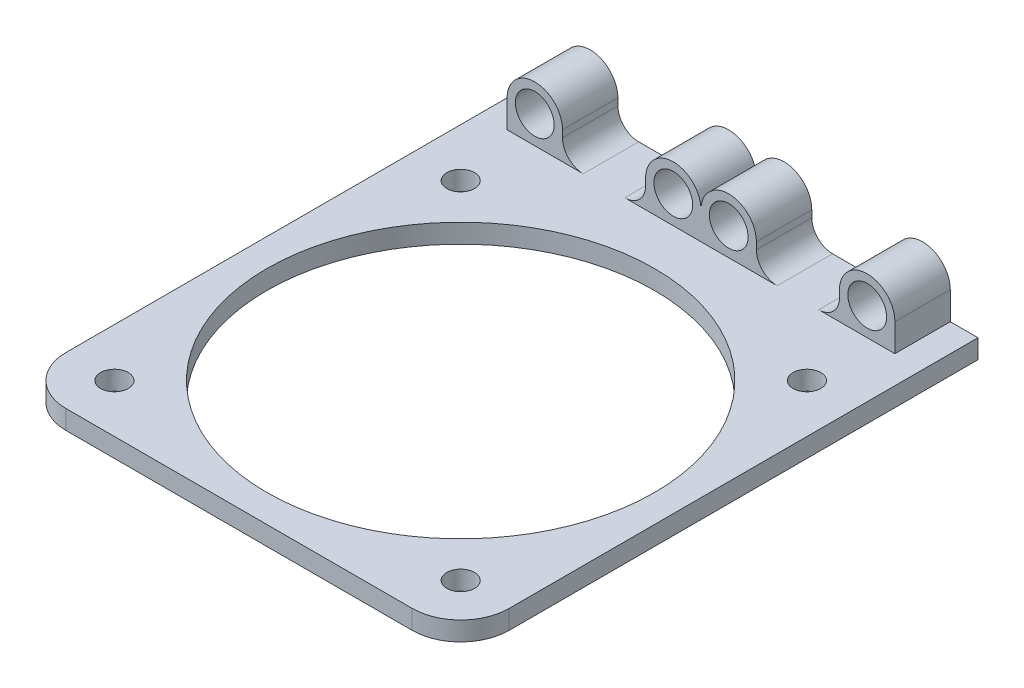
from build123d import *

# Parameters (mm, degrees)
SCHIZZO1_R                        = 2
ESTRUSIONE_ESTRUSIONE1_DEPTH      = 8
SCHIZZO3_W                        = 50
SCHIZZO3_H                        = 2.75
ESTRUSIONE_ESTRUSIONE3_DEPTH      = 55
RACCORDO1_R                       = 4
SCHIZZO4_R                        = 23
TAGLIO_ESTRUSIONE1_DEPTH          = 4
SCHIZZO5_R                        = 2
TAGLIO_ESTRUSIONE2_DEPTH          = 4
RACCORDO2_R                       = 124
SCHIZZO6_R                        = 2.8
TAGLIO_ESTRUSIONE3_DEPTH          = 4
SCHIZZO7_W                        = 64
SCHIZZO7_H                        = 66
SCHIZZO7_R                        = 28
ESTRUSIONE_ESTRUSIONE4_DEPTH      = 4
SCHIZZO8_R                        = 28
TAGLIO_ESTRUSIONE4_DEPTH          = 10
SCHIZZO9_R                        = 2
TAGLIO_ESTRUSIONE5_DEPTH          = 4
RACCORDO3_R                       = 3
RACCORDO4_R                       = 3
RACCORDO5_R                       = 3
SCHIZZO10_W                       = 88.736042833
SCHIZZO10_H                       = 81.022332295
TAGLIO_ESTRUSIONE6_DEPTH          = 1.25
SCHIZZO11_W                       = 58
SCHIZZO11_H                       = 2.75
ESTRUSIONE_ESTRUSIONE5_DEPTH      = 0.7
RACCORDO6_START                   = -1
RACCORDO6_DEPTH                   = 5
RACCORDO8_START                   = -1
RACCORDO8_DEPTH                   = 5
ESTRUSIONE_ESTRUSIONE6_DEPTH      = 4
ESTRUSIONE_ESTRUSIONE6_DEPTH_BACK = 2.75
SCHIZZO12_W                       = 64
SCHIZZO12_H                       = 11.748328584
TAGLIO_ESTRUSIONE7_DEPTH          = 4
SCHIZZO15_W                       = 64
SCHIZZO15_H                       = 14.540634193
TAGLIO_ESTRUSIONE8_DEPTH          = 4


with BuildPart() as part:
    # Schizzo1 → Estrusione-Estrusione1 (new body)
    with BuildSketch(Plane.XY):
        with BuildLine():
            Line((-59.484364928, 0), (-3.484364928, 0))
            Line((-3.484364928, 0), (-3.484364928, 6.75))
            ThreePointArc((-3.484364928, 6.75), (-7.484364928, 10.75), (-11.484364928, 6.75))
            Line((-11.484364928, 6.75), (-11.484364928, 2.75))
            Line((-11.484364928, 2.75), (-23.484364928, 2.75))
            Line((-23.484364928, 2.75), (-23.484364928, 6.75))
            ThreePointArc((-23.484364928, 6.75), (-27.484364928, 10.75), (-31.484364928, 6.75))
            ThreePointArc((-31.484364928, 6.75), (-35.484364928, 10.75), (-39.484364928, 6.75))
            Line((-39.484364928, 6.75), (-39.484364928, 2.75))
            Line((-39.484364928, 2.75), (-51.484364928, 2.75))
            Line((-51.484364928, 2.75), (-51.484364928, 6.75))
            ThreePointArc((-51.484364928, 6.75), (-55.484364928, 10.75), (-59.484364928, 6.75))
            Line((-59.484364928, 6.75), (-59.484364928, 0))
        make_face()
        with Locations((-35.484364928, 6.75)):
            Circle(SCHIZZO1_R, mode=Mode.SUBTRACT)
        with Locations(Location((-27.484364928, 6.75, 0), (0, 0, 180))):
            Circle(SCHIZZO1_R, mode=Mode.SUBTRACT)
        with Locations((-55.484364928, 6.75)):
            Circle(SCHIZZO1_R, mode=Mode.SUBTRACT)
        with Locations(Location((-7.484364928, 6.75, 0), (0, 0, 180))):
            Circle(SCHIZZO1_R, mode=Mode.SUBTRACT)
    extrude(amount=ESTRUSIONE_ESTRUSIONE1_DEPTH)

    # Schizzo3 → Estrusione-Estrusione3 (add)
    with BuildSketch(Plane.XY.offset(8)):
        with Locations((-31.482821648, 1.375)):
            Rectangle(SCHIZZO3_W, SCHIZZO3_H)
    extrude(amount=ESTRUSIONE_ESTRUSIONE3_DEPTH)

    # Raccordo1
    raccordo1_edges = [part.edges().sort_by_distance(p)[0] for p in [
        (-56.482821648, 1.375, 63),
        (-6.482821648, 1.375, 63),
    ]]
    fillet(raccordo1_edges, radius=RACCORDO1_R)

    # Schizzo4 → Taglio-Estrusione1 (cut)
    with BuildSketch(Plane(origin=(0, 2.75, 0), x_dir=(1, 0, 0), z_dir=(0, 1, 0))):
        with Locations(Location((-31.482821648, -35.97589666, 0), (0, 0, 180))):
            Circle(SCHIZZO4_R)
    extrude(amount=-TAGLIO_ESTRUSIONE1_DEPTH, mode=Mode.SUBTRACT)

    # Schizzo5 → Taglio-Estrusione2 (cut)
    with BuildSketch(Plane(origin=(0, 2.75, 0), x_dir=(1, 0, 0), z_dir=(0, 1, 0))):
        with Locations(Location((-51.482821648, -15.97589666, 0), (0, 0, 180))):
            Circle(SCHIZZO5_R)
        with Locations(Location((-51.482821648, -55.97589666, 0), (0, 0, 180))):
            Circle(SCHIZZO5_R)
        with Locations(Location((-11.482821648, -15.97589666, 0), (0, 0, 180))):
            Circle(SCHIZZO5_R)
        with Locations(Location((-11.482821648, -55.97589666, 0), (0, 0, 180))):
            Circle(SCHIZZO5_R)
    extrude(amount=-TAGLIO_ESTRUSIONE2_DEPTH, mode=Mode.SUBTRACT)

    # Raccordo2
    # the kernel refuses this fillet: 124 mm, written as the material it adds along each edge
    with BuildSketch(Plane(origin=(-56.482821648, 2.75, 8), x_dir=(0, 0, 1), z_dir=(0, -1, 0))) as raccordo2_piece_1:
        with BuildLine():
            CenterArc((27.117770399, 124), RACCORDO2_R, 257.367798326, 12.632201674)
            Line((0, 3.00154328), (0, 0))
            Line((0, 0), (27.117770399, 0))
        make_face()
    extrude(amount=2.75)
    with BuildSketch(Plane(origin=(-6.482821648, 0, 8), x_dir=(0, 0, 1), z_dir=(0, 1, 0))) as raccordo2_piece_2:
        with BuildLine():
            CenterArc((27.10399461, 124), RACCORDO2_R, 257.374321421, 12.625678579)
            Line((0, 2.99845672), (0, 0))
            Line((0, 0), (27.10399461, 0))
        make_face()
    extrude(amount=2.75)

    # Schizzo6 → Taglio-Estrusione3 (cut)
    with BuildSketch(Plane.XY.offset(8)):
        with Locations((-55.484364928, 6.75)):
            Circle(SCHIZZO6_R)
        with Locations((-35.484364928, 6.75)):
            Circle(SCHIZZO6_R)
        with Locations((-27.48263887, 6.745335699)):
            Circle(SCHIZZO6_R)
        with Locations((-7.48260826, 6.745335699)):
            Circle(SCHIZZO6_R)
    extrude(amount=-TAGLIO_ESTRUSIONE3_DEPTH, mode=Mode.SUBTRACT)

    # Schizzo7 → Estrusione-Estrusione4 (add)
    with BuildSketch(Plane(origin=(0, 2.75, 0), x_dir=(1, 0, 0), z_dir=(0, 1, 0))):
        with Locations((-31.484364928, -41)):
            Rectangle(SCHIZZO7_W, SCHIZZO7_H)
        with Locations(Location((-31.484364928, -42.7, 0), (0, 0, 180))):
            Circle(SCHIZZO7_R, mode=Mode.SUBTRACT)
    extrude(amount=-ESTRUSIONE_ESTRUSIONE4_DEPTH)

    # Schizzo8 → Taglio-Estrusione4 (cut)
    with BuildSketch(Plane(origin=(0, 2.75, 0), x_dir=(1, 0, 0), z_dir=(0, 1, 0))):
        with Locations(Location((-31.484364928, -42.7, 0), (0, 0, 180))):
            Circle(SCHIZZO8_R)
    extrude(amount=-TAGLIO_ESTRUSIONE4_DEPTH, mode=Mode.SUBTRACT)

    # Schizzo9 → Taglio-Estrusione5 (cut)
    with BuildSketch(Plane(origin=(0, 2.75, 0), x_dir=(1, 0, 0), z_dir=(0, 1, 0))):
        with Locations(Location((-6.484364928, -67.7, 0), (0, 0, 180))):
            Circle(SCHIZZO9_R)
        with Locations((-6.484364928, -17.7)):
            Circle(SCHIZZO9_R)
        with Locations((-56.484364928, -67.7)):
            Circle(SCHIZZO9_R)
        with Locations(Location((-56.484364928, -17.7, 0), (0, 0, 180))):
            Circle(SCHIZZO9_R)
    extrude(amount=-TAGLIO_ESTRUSIONE5_DEPTH, mode=Mode.SUBTRACT)

    # Raccordo3
    # the kernel refuses this fillet: 3 mm, written as the material it adds along each edge
    with BuildSketch(Plane(origin=(-59.484364928, 0, 8), x_dir=(0, -1, 0), z_dir=(1, 0, 0))) as raccordo3_piece_1:
        with BuildLine():
            CenterArc((3, 2.436698586), RACCORDO3_R, 180, 54.314665287)
            Line((0, 2.436698586), (0, 0))
            Line((0, 0), (1.25, 0))
        make_face()
    extrude(amount=56)
    with BuildSketch(Plane(origin=(-3.484364928, 0, 8), x_dir=(1, 0, 0), z_dir=(0, 1, 0)), Plane(origin=(-59.484364928, 2.75, 8), x_dir=(-1, 0, 0), z_dir=(0, -1, 0))) as raccordo3_piece_2:
        with BuildLine():
            CenterArc((RACCORDO3_R, RACCORDO3_R), RACCORDO3_R, 180, 90)
            Line((0, RACCORDO3_R), (0, 0))
            Line((0, 0), (RACCORDO3_R, 0))
        make_face()
    extrude(amount=2.75)
    with BuildSketch(Plane(origin=(-65.576111393, 0, 8), x_dir=(0, -1, 0), z_dir=(1, 0, 0))) as raccordo3_piece_3a_section:
        with BuildLine():
            CenterArc((3, 2.436698586), RACCORDO3_R, 180, 54.314665287)
            Line((0, 2.436698586), (0, 0))
            Line((0, 0), (1.25, 0))
        make_face()
    raccordo3_piece_3a = extrude(amount=62.091746466, mode=Mode.PRIVATE)
    raccordo3_piece_3a = split(raccordo3_piece_3a, bisect_by=Plane(origin=(-63.484364928, 0, 8), z_dir=(1, 0, 0)), keep=Keep.TOP, mode=Mode.PRIVATE)
    raccordo3_piece_3a = split(raccordo3_piece_3a, bisect_by=Plane(origin=(-59.484364928, 0, 8), z_dir=(-1, 0, 0)), keep=Keep.TOP, mode=Mode.PRIVATE)
    with BuildSketch(Plane(origin=(-59.484364928, 2.75, 8), x_dir=(-1, 0, 0), z_dir=(0, -1, 0))) as raccordo3_piece_3b_section:
        with BuildLine():
            CenterArc((RACCORDO3_R, RACCORDO3_R), RACCORDO3_R, 180, 90)
            Line((0, RACCORDO3_R), (0, 0))
            Line((0, 0), (RACCORDO3_R, 0))
        make_face()
    raccordo3_piece_3b = extrude(amount=10.25, mode=Mode.PRIVATE)
    raccordo3_piece_3b = split(raccordo3_piece_3b, bisect_by=Plane(origin=(-59.484364928, 0, 8), z_dir=(0, -1, 0)), keep=Keep.TOP, mode=Mode.PRIVATE)
    raccordo3_piece_3b = split(raccordo3_piece_3b, bisect_by=Plane(origin=(-59.484364928, -1.25, 8), z_dir=(0, 1, 0)), keep=Keep.TOP, mode=Mode.PRIVATE)
    raccordo3_piece_3 = raccordo3_piece_3a & raccordo3_piece_3b
    add(raccordo3_piece_3)
    with BuildSketch(Plane(origin=(-3.484364928, -7.5, 8), x_dir=(1, 0, 0), z_dir=(0, 1, 0))) as raccordo3_piece_4a_section:
        with BuildLine():
            CenterArc((RACCORDO3_R, RACCORDO3_R), RACCORDO3_R, 180, 90)
            Line((0, RACCORDO3_R), (0, 0))
            Line((0, 0), (RACCORDO3_R, 0))
        make_face()
    raccordo3_piece_4a = extrude(amount=10.25, mode=Mode.PRIVATE)
    raccordo3_piece_4a = split(raccordo3_piece_4a, bisect_by=Plane(origin=(-3.484364928, 0, 8), z_dir=(0, -1, 0)), keep=Keep.TOP, mode=Mode.PRIVATE)
    raccordo3_piece_4a = split(raccordo3_piece_4a, bisect_by=Plane(origin=(-3.484364928, -1.25, 8), z_dir=(0, 1, 0)), keep=Keep.TOP, mode=Mode.PRIVATE)
    with BuildSketch(Plane(origin=(-59.484364928, 0, 8), x_dir=(0, -1, 0), z_dir=(1, 0, 0))) as raccordo3_piece_4b_section:
        with BuildLine():
            CenterArc((3, 2.436698586), RACCORDO3_R, 180, 54.314665287)
            Line((0, 2.436698586), (0, 0))
            Line((0, 0), (1.25, 0))
        make_face()
    raccordo3_piece_4b = extrude(amount=62.091746466, mode=Mode.PRIVATE)
    raccordo3_piece_4b = split(raccordo3_piece_4b, bisect_by=Plane(origin=(0.515635072, 0, 8), z_dir=(-1, 0, 0)), keep=Keep.TOP, mode=Mode.PRIVATE)
    raccordo3_piece_4b = split(raccordo3_piece_4b, bisect_by=Plane(origin=(-3.484364928, 0, 8), z_dir=(1, 0, 0)), keep=Keep.TOP, mode=Mode.PRIVATE)
    raccordo3_piece_4 = raccordo3_piece_4a & raccordo3_piece_4b
    add(raccordo3_piece_4)
    # the kernel refuses this fillet: 3 mm, written as the material it takes off along each edge
    with BuildSketch(Plane(origin=(0.515635072, 10.25, 74), x_dir=(-1, 0, 0), z_dir=(0, -1, 0)), Plane(origin=(-63.484364928, 10.25, 74), x_dir=(0, 0, -1), z_dir=(0, -1, 0))) as raccordo3_2_piece_1:
        with BuildLine():
            CenterArc((RACCORDO3_R, RACCORDO3_R), RACCORDO3_R, 180, 90)
            Line((0, RACCORDO3_R), (0, 0))
            Line((0, 0), (RACCORDO3_R, 0))
        make_face()
    extrude(amount=19, mode=Mode.SUBTRACT)

    # Raccordo4
    # the kernel refuses this fillet: 3 mm, written as the material it takes off along each edge
    with BuildSketch(Plane(origin=(-63.484364928, 9.392135624, 8), x_dir=(0.9963405296085128, 0, -0.08547250469845889), z_dir=(0, -1, 0))) as raccordo4_piece_1:
        with BuildLine():
            CenterArc((2.761933602, 2.903549084), RACCORDO4_R, 184.903196278, 70.528779366)
            Line((-0.227087987, 2.64713157), (-0.525990146, 2.621489819))
            Line((-0.525990146, 2.621489819), (-0.298902159, -0.025641751))
            Line((-0.298902159, -0.025641751), (0.025641751, -0.298902159))
            ThreePointArc((0.025641751, -0.298902159), (1.021982281, -0.213429654), (1.931887045, -0.290354908))
            Line((1.931887045, -0.290354908), (2.007345823, 0))
        make_face()
    extrude(amount=17.284271247, mode=Mode.SUBTRACT)
    with BuildSketch(Plane(origin=(0.515635072, 9.392135624, 8), x_dir=(-0.9963405296085196, 0, -0.08547250469837912), z_dir=(0, -1, 0))) as raccordo4_piece_2:
        with BuildLine():
            CenterArc((2.761933602, -2.903549084), RACCORDO4_R, 104.568024357, 70.528779366)
            Line((-0.227087987, -2.64713157), (-0.525990146, -2.621489819))
            Line((-0.525990146, -2.621489819), (-0.298902159, 0.025641751))
            Line((-0.298902159, 0.025641751), (0.025641751, 0.298902159))
            ThreePointArc((0.025641751, 0.298902159), (1.021982281, 0.213429654), (1.931887045, 0.290354908))
            Line((1.931887045, 0.290354908), (2.007345823, 0))
        make_face()
    extrude(amount=17.284271247, mode=Mode.SUBTRACT)

    # Raccordo5
    raccordo5_edges = [part.edges().sort_by_distance(p)[0] for p in [
        (-39.484364928, 2.75, 4),
        (-51.484364928, 2.75, 4),
        (-23.484364928, 2.75, 4),
        (-11.484364928, 2.75, 4),
    ]]
    fillet(raccordo5_edges, radius=RACCORDO5_R)

    # Schizzo10 → Taglio-Estrusione6 (cut)
    with BuildSketch(Plane.XZ.offset(1.25)):
        with Locations((-36.992061707, 40.511166147)):
            Rectangle(SCHIZZO10_W, SCHIZZO10_H)
    extrude(amount=-TAGLIO_ESTRUSIONE6_DEPTH, mode=Mode.SUBTRACT)

    # Schizzo11 → Estrusione-Estrusione5 (add)
    with BuildSketch(Plane.XY.offset(74)):
        with Locations((-31.484364928, 1.375)):
            Rectangle(SCHIZZO11_W, SCHIZZO11_H)
    extrude(amount=ESTRUSIONE_ESTRUSIONE5_DEPTH)

    # Raccordo6: read off the stored shape, not the designer's step
    # Raccordo6 outline → Raccordo6 (cut)
    with BuildSketch(Plane(origin=(0, 0, 0), x_dir=(1, 0, 0), z_dir=(0, 1, 0)).offset(RACCORDO6_START)):
        with BuildLine():
            Line((-60.484364928, -74.7), (-56.484364928, -74.7))
            ThreePointArc((-56.484364928, -74.7), (-61.434112396, -72.649747468), (-63.484364928, -67.7))
            Line((-63.484364928, -67.7), (-63.484364928, -71))
            ThreePointArc((-63.484364928, -71), (-62.605685271, -73.121320344), (-60.484364928, -74))
            Line((-60.484364928, -74), (-60.484364928, -74.7))
        make_face()
    extrude(amount=RACCORDO6_DEPTH, mode=Mode.SUBTRACT)

    # Raccordo8: read off the stored shape, not the designer's step
    # Raccordo8 outline → Raccordo8 (cut)
    with BuildSketch(Plane(origin=(0, 0, 0), x_dir=(1, 0, 0), z_dir=(0, 1, 0)).offset(RACCORDO8_START)):
        with BuildLine():
            ThreePointArc((0.515635072, -67.7), (-1.53461746, -72.649747468), (-6.484364928, -74.7))
            Line((-6.484364928, -74.7), (-2.484364928, -74.7))
            Line((-2.484364928, -74.7), (-2.484364928, -74))
            ThreePointArc((-2.484364928, -74), (-0.363044584, -73.121320344), (0.515635072, -71))
            Line((0.515635072, -71), (0.515635072, -67.7))
        make_face()
    extrude(amount=RACCORDO8_DEPTH, mode=Mode.SUBTRACT)

    # Schizzo12 → Estrusione-Estrusione6 (add, two sides: drawn at the far end of the back side and taken through both)
    with BuildSketch(Plane.XZ.offset(-ESTRUSIONE_ESTRUSIONE6_DEPTH_BACK)):
        with Locations((-31.484364928, 5.874164292)):
            Rectangle(SCHIZZO12_W, SCHIZZO12_H)
    extrude(amount=ESTRUSIONE_ESTRUSIONE6_DEPTH + ESTRUSIONE_ESTRUSIONE6_DEPTH_BACK)

    # Schizzo14 → Taglio-Estrusione7 (cut)
    with BuildSketch(Plane.XZ.offset(4)):
        with BuildLine():
            ThreePointArc((-63.784364872, 15.695561242), (-63.487200964, 13.638374938), (-62.622304057, 11.748328584))
            Line((-62.622304057, 11.748328584), (-31.484364928, 11.748328584))
            Line((-31.484364928, 11.748328584), (-31.484364928, 15.695561242))
            Line((-31.484364928, 15.695561242), (-63.784364872, 15.695561242))
        make_face()
        with BuildLine():
            Line((-31.484364928, 15.695561242), (-31.484364928, 11.748328584))
            Line((-31.484364928, 11.748328584), (-0.346425799, 11.748328584))
            ThreePointArc((-0.346425799, 11.748328584), (0.518471108, 13.638374938), (0.815635017, 15.695561242))
            Line((0.815635017, 15.695561242), (-31.484364928, 15.695561242))
        make_face()
        with BuildLine():
            Line((-31.484364928, 11.748328584), (-31.484364928, 8.4))
            Line((-31.484364928, 8.4), (-30.756456371, 8.4))
            Line((-30.756456371, 8.4), (-6.48436489, 8.4))
            ThreePointArc((-6.48436489, 8.4), (-2.988453083, 9.291521392), (-0.346425799, 11.748328584))
            Line((-0.346425799, 11.748328584), (-31.484364928, 11.748328584))
        make_face()
        with BuildLine():
            ThreePointArc((-62.622304057, 11.748328584), (-59.980276772, 9.291521392), (-56.484364966, 8.4))
            Line((-56.484364966, 8.4), (-32.212273485, 8.4))
            Line((-32.212273485, 8.4), (-31.484364928, 8.4))
            Line((-31.484364928, 8.4), (-31.484364928, 11.748328584))
            Line((-31.484364928, 11.748328584), (-62.622304057, 11.748328584))
        make_face()
    extrude(amount=-TAGLIO_ESTRUSIONE7_DEPTH, mode=Mode.SUBTRACT)

    # Schizzo15 → Taglio-Estrusione8 (cut)
    with BuildSketch(Plane.XZ.offset(4)):
        with Locations((-31.484364928, 7.270317097)):
            Rectangle(SCHIZZO15_W, SCHIZZO15_H)
    extrude(amount=-TAGLIO_ESTRUSIONE8_DEPTH, mode=Mode.SUBTRACT)


solid = part.part
